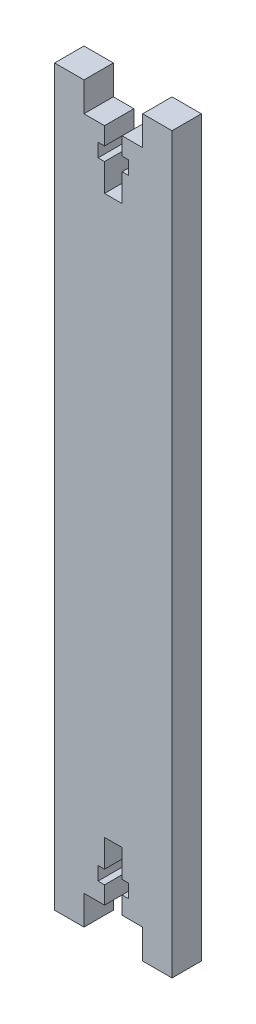
from build123d import *

# Parameters (mm, degrees)
BOSS_EXTRUDE1_DEPTH = 5


with BuildPart() as part:
    # Sketch1 → Boss-Extrude1 (new body)
    with BuildSketch(Plane.XY):
        Polygon((-1.5, 0), (-5, 0), (-5, -5), (-10, -5), (-10, 0), (-10, 115), (-10, 120), (-5, 120), (-5, 115), (-1.5, 115), (-1.5, 112), (-2.6, 112), (-2.6, 109.7), (-1.5, 109.7), (-1.5, 105), (1.5, 105), (1.5, 109.7), (2.6, 109.7), (2.6, 112), (1.5, 112), (1.5, 115), (5, 115), (5, 120), (10, 120), (10, 115), (10, 0), (10, -5), (5, -5), (5, 0), (1.5, 0), (1.5, 3), (2.6, 3), (2.6, 5.3), (1.5, 5.3), (1.5, 10), (-1.5, 10), (-1.5, 5.3), (-2.6, 5.3), (-2.6, 3), (-1.5, 3), align=None)
    extrude(amount=BOSS_EXTRUDE1_DEPTH)


solid = part.part
